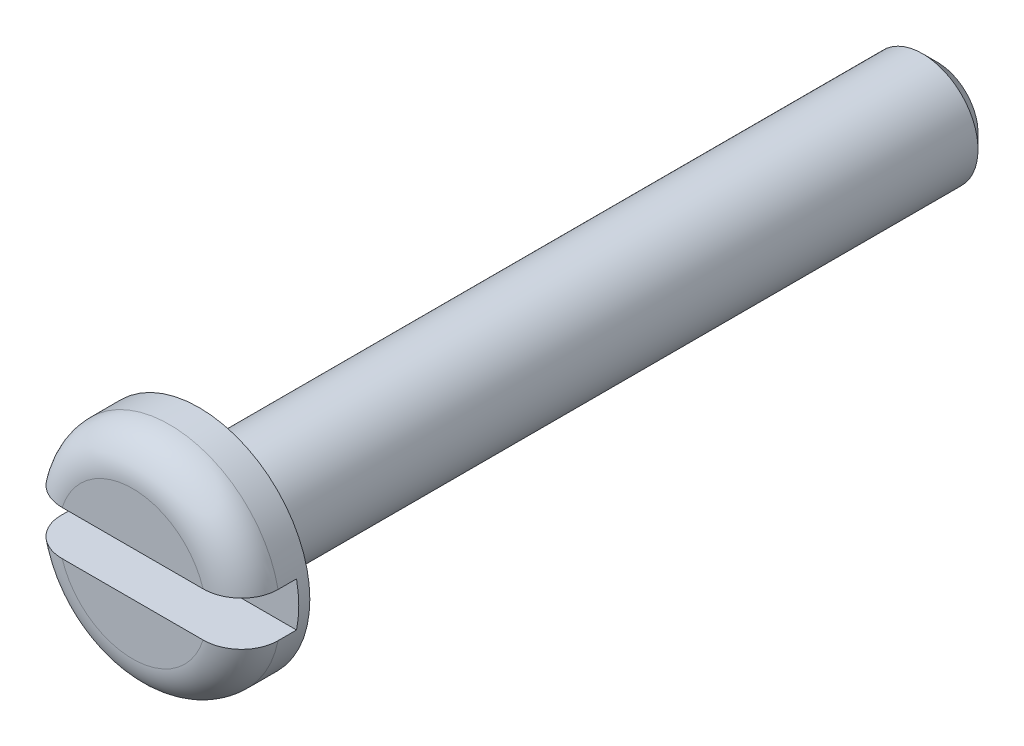
from build123d import *

# Parameters (mm, degrees)
CUT_EXTRUDE_1_DEPTH      = 23.209007182
CUT_EXTRUDE_1_DEPTH_BACK = 23.209007182
SKETCH_2_W               = 1.5
SKETCH_2_H               = 1.2
CHAMFER_1_SIZE           = 0.4
FILLET_1_R               = 1
FILLET_2_R               = 0.4


with BuildPart() as part:
    # Эскиз1 → Повернуть1 (revolve)
    with BuildSketch(Plane(origin=(0, 0, 0), x_dir=(1, 0, 0), z_dir=(0, 1, 0))):
        Polygon((0, 0), (-3, 0), (-3, 1.8), (-1.5, 1.8), (-1.5, 21.8), (0, 21.8), align=None)
    revolve(axis=Axis((0, 0, -21.8), (0, 0, 1)))

    # Эскиз2 → Вырез-Вытянуть1 (cut, two sides: drawn at the far end of the back side and taken through both)
    with BuildSketch(Plane(origin=(0, 0, 0), x_dir=(0, 0, -1), z_dir=(1, 0, 0)).offset(-CUT_EXTRUDE_1_DEPTH_BACK)):
        with Locations((0.75, 0)):
            Rectangle(SKETCH_2_W, SKETCH_2_H)
    extrude(amount=CUT_EXTRUDE_1_DEPTH + CUT_EXTRUDE_1_DEPTH_BACK, mode=Mode.SUBTRACT)

    # Фаска1
    chamfer_1_edges = [part.edges().sort_by_distance(p)[0] for p in [
        (1.5, 0, -21.8),
    ]]
    chamfer(chamfer_1_edges, length=CHAMFER_1_SIZE)

    # Скругление1
    fillet_1_edges = [part.edges().sort_by_distance(p)[0] for p in [
        (0, -3, 0),
        (0, 3, 0),
    ]]
    fillet(fillet_1_edges, radius=FILLET_1_R)

    # Скругление2
    fillet_2_edges = [part.edges().sort_by_distance(p)[0] for p in [
        (1.5, 0, -1.8),
    ]]
    fillet(fillet_2_edges, radius=FILLET_2_R)


solid = part.part
